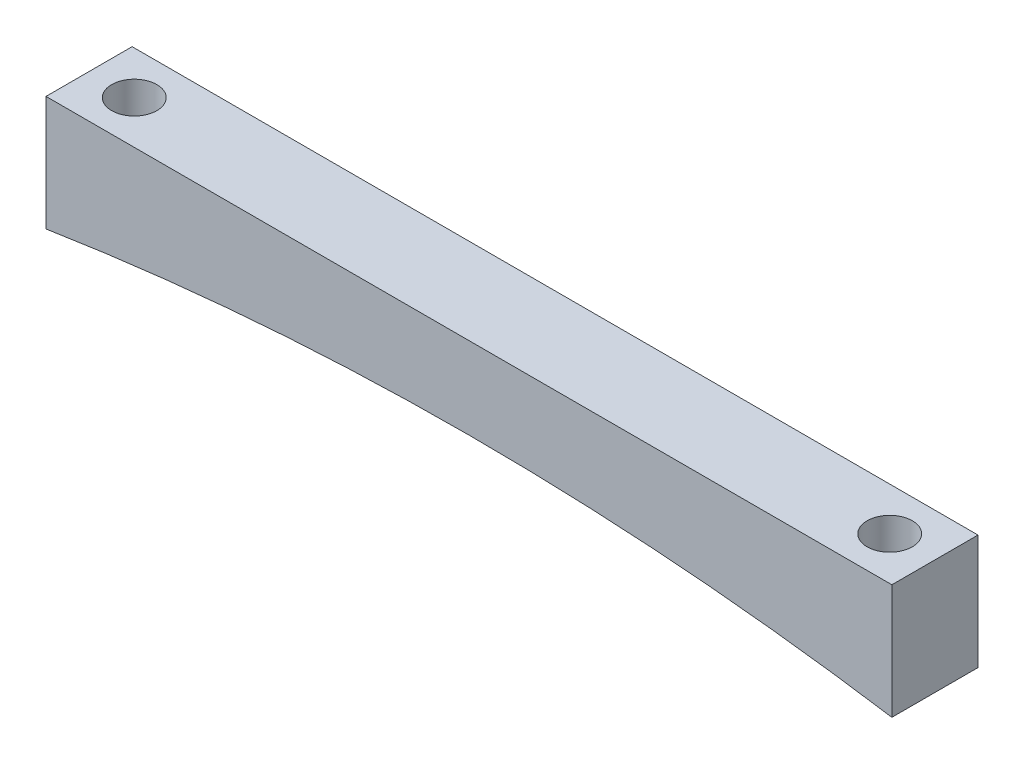
from build123d import *

# Parameters (mm, degrees)
BOSS_EXTRUDE1_DEPTH = 7.62
SKETCH2_R           = 2
CUT_EXTRUDE1_DEPTH  = 6.5


with BuildPart() as part:
    # Sketch1 → Boss-Extrude1 (new body)
    with BuildSketch(Plane.XY):
        with BuildLine():
            Line((-37.4204564, 0), (37.4204564, 0))
            Line((37.4204564, 0), (37.4204564, -10.16))
            ThreePointArc((37.4204564, -10.16), (0, -7.240786648), (-37.4204564, -10.16))
            Line((-37.4204564, -10.16), (-37.4204564, 0))
        make_face()
    extrude(amount=BOSS_EXTRUDE1_DEPTH)

    # Sketch2 → Cut-Extrude1 (cut)
    with BuildSketch(Plane(origin=(0, 0, 0), x_dir=(1, 0, 0), z_dir=(0, 1, 0))):
        with Locations((-33.4204564, -3.81)):
            Circle(SKETCH2_R)
        with Locations((33.4204564, -3.81)):
            Circle(SKETCH2_R)
    extrude(amount=-CUT_EXTRUDE1_DEPTH, mode=Mode.SUBTRACT)


solid = part.part
